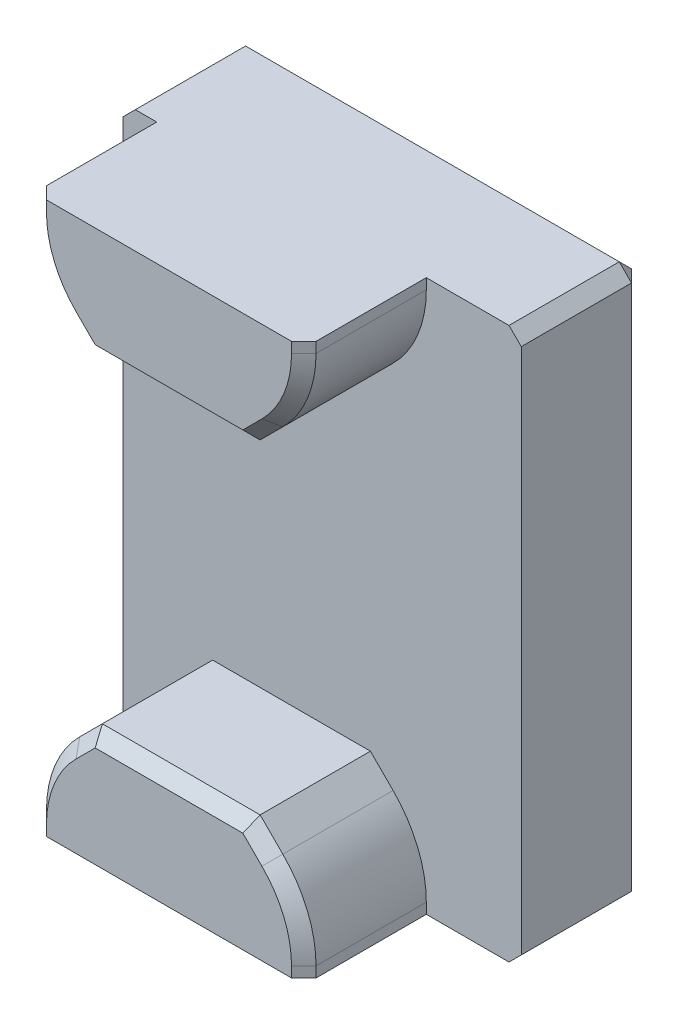
from build123d import *

# Parameters (mm, degrees)
BOSS_EXTRUDE1_DEPTH = 2
SLOT_TAB_DEPTH      = 2
DEBURS_SIZE         = 0.2


with BuildPart() as part:
    # Sketch1 → Boss-Extrude1 (new body)
    with BuildSketch(Plane.XY):
        Polygon((-2.75, -4.5), (2.75, -4.5), (3.75, -4.5), (3.75, 4.5), (2.75, 4.5), (-2.75, 4.5), align=None)
    extrude(amount=-BOSS_EXTRUDE1_DEPTH)

    # Sketch2 → Slot Tab (add)
    with BuildSketch(Plane.XY):
        with BuildLine():
            Line((1.658147545, -3.02027958), (1.287867966, -2.65))
            Line((1.287867966, -2.65), (-1.287867966, -2.65))
            Line((-1.287867966, -2.65), (-1.658147545, -3.02027958))
            ThreePointArc((-1.658147545, -3.02027958), (-2.059177135, -3.620462775), (-2.2, -4.328427125))
            Line((-2.2, -4.328427125), (-2.2, -4.5))
            Line((-2.2, -4.5), (2.2, -4.5))
            Line((2.2, -4.5), (2.2, -4.328427125))
            ThreePointArc((2.2, -4.328427125), (2.059177135, -3.620462775), (1.658147545, -3.02027958))
        make_face()
    slot_tab = extrude(amount=SLOT_TAB_DEPTH)

    # Slot Tabs: Slot Tab across plane
    add(slot_tab.mirror(Plane.ZX))

    # Deburs
    deburs_edges = [part.edges().sort_by_distance(p)[0] for p in [
        (0.5, -4.5, -2),
        (-2.75, -4.5, -1),
        (-2.75, 0, -2),
        (-2.75, 4.5, -1),
        (0.5, 4.5, -2),
        (3.75, 0, -2),
        (3.75, -4.5, -1),
        (3.75, 4.5, -1),
        (2.2, -4.414213562, 2),
        (-2.2, -4.414213562, 2),
        (2.059177135, -3.620462775, 2),
        (-2.059177135, -3.620462775, 2),
        (1.473007755, -2.83513979, 2),
        (0, -2.65, 2),
        (-1.473007755, -2.83513979, 2),
        (2.2, 4.414213562, 2),
        (-2.2, 4.414213562, 2),
        (2.059177135, 3.620462775, 2),
        (-2.059177135, 3.620462775, 2),
        (1.473007755, 2.83513979, 2),
        (0, 2.65, 2),
        (-1.473007755, 2.83513979, 2),
    ]]
    chamfer(deburs_edges, length=DEBURS_SIZE)


solid = part.part
